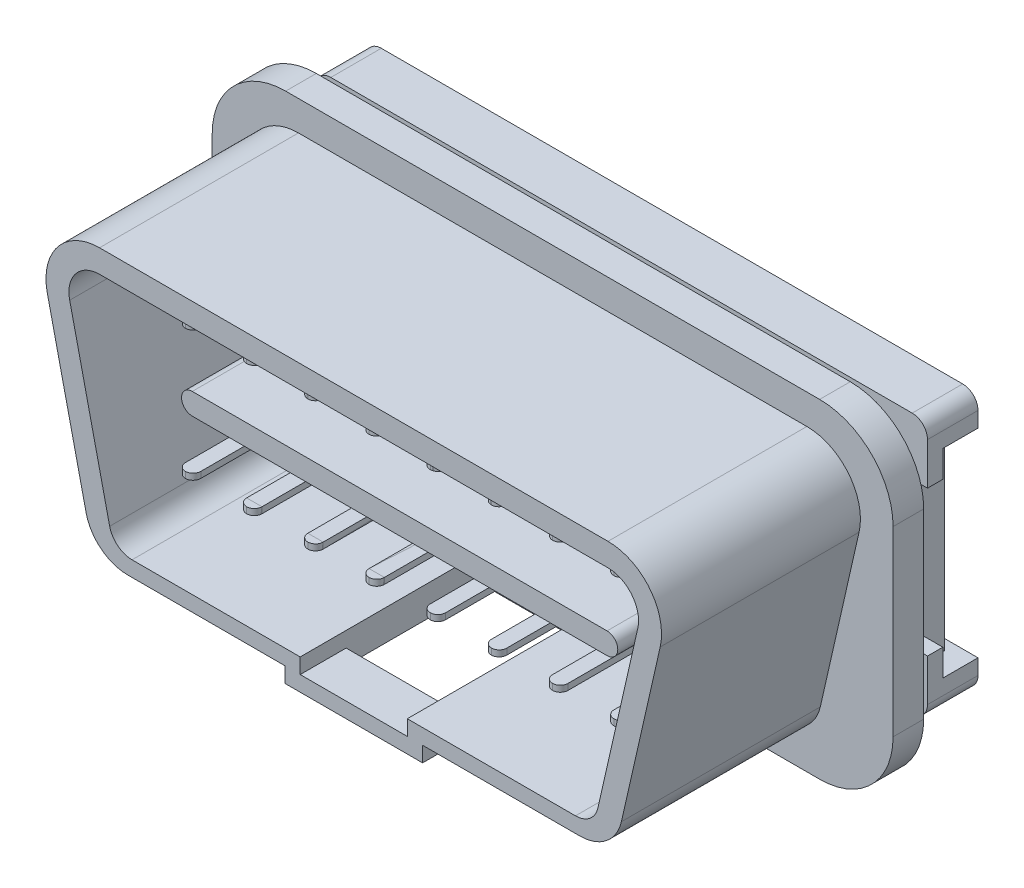
from build123d import *

# Parameters (mm, degrees)
SKETCH1_W             = 44.5
SKETCH1_H             = 21.5
BOSS_EXTRUDE1_DEPTH   = 2
BOSS_EXTRUDE2_DEPTH   = 13
SKETCH3_W             = 9
SKETCH3_H             = 1
BOSS_EXTRUDE3_DEPTH   = 13
SKETCH4_W             = 7
SKETCH4_H             = 1
CUT_EXTRUDE1_DEPTH    = 13
SKETCH5_W             = 7
SKETCH5_H             = 10
CUT_EXTRUDE2_DEPTH    = 34.200376504
BOSS_EXTRUDE4_DEPTH   = 10
SKETCH7_W             = 36
SKETCH7_H             = 13.5
BOSS_EXTRUDE5_DEPTH   = 2.5
SKETCH8_W             = 40
SKETCH8_H             = 3.75
BOSS_EXTRUDE6_DEPTH   = 1
SKETCH9_W             = 40
SKETCH9_H             = 2
BOSS_EXTRUDE7_DEPTH   = 2.3
SKETCH10_W            = 37
SKETCH10_H            = 13
BOSS_EXTRUDE8_DEPTH   = 1.6
BOSS_EXTRUDE9_START   = -8.6
SKETCH11_W            = 1
SKETCH11_H            = 0.4
BOSS_EXTRUDE9_DEPTH   = 18.6
BOSS_EXTRUDE9_2_DEPTH = 18.6
FILLET1_R             = 0.5
FILLET2_R             = 0.5
LPATTERN4_COUNT       = 4
LPATTERN4_PITCH       = 4
LPATTERN4_2_COUNT     = 5
LPATTERN4_2_PITCH     = 4
FILLET3_R             = 4.8
FILLET4_R             = 1


with BuildPart() as part:
    # Sketch1 → Boss-Extrude1 (new body)
    with BuildSketch(Plane.XY):
        Rectangle(SKETCH1_W, SKETCH1_H)
    extrude(amount=BOSS_EXTRUDE1_DEPTH)

    # Sketch2 → Boss-Extrude2 (add)
    with BuildSketch(Plane.XY.offset(2)):
        with BuildLine():
            Line((-16.615290945, 8.8), (16.615290945, 8.8))
            ThreePointArc((16.615290945, 8.8), (19.350693888, 7.483476755), (20.02825594, 4.524326137))
            Line((20.02825594, 4.524326137), (17.492629169, -6.632431655))
            ThreePointArc((17.492629169, -6.632431655), (16.514405691, -8.191660068), (14.77715587, -8.8))
            Line((14.77715587, -8.8), (-14.77715587, -8.8))
            ThreePointArc((-14.77715587, -8.8), (-16.514405691, -8.191660068), (-17.492629169, -6.632431655))
            Line((-17.492629169, -6.632431655), (-20.02825594, 4.524326137))
            ThreePointArc((-20.02825594, 4.524326137), (-19.350693888, 7.483476755), (-16.615290945, 8.8))
        make_face()
        with BuildLine():
            Line((-16.615290945, 7.3), (16.615290945, 7.3))
            ThreePointArc((16.615290945, 7.3), (18.178378341, 6.547701003), (18.565556657, 4.856757793))
            Line((18.565556657, 4.856757793), (15.954377237, -6.632431655))
            ThreePointArc((15.954377237, -6.632431655), (15.427453705, -7.472315547), (14.491677953, -7.8))
            Line((14.491677953, -7.8), (-14.491677953, -7.8))
            ThreePointArc((-14.491677953, -7.8), (-15.427453705, -7.472315547), (-15.954377237, -6.632431655))
            Line((-15.954377237, -6.632431655), (-18.565556657, 4.856757793))
            ThreePointArc((-18.565556657, 4.856757793), (-18.178378341, 6.547701003), (-16.615290945, 7.3))
        make_face(mode=Mode.SUBTRACT)
    extrude(amount=BOSS_EXTRUDE2_DEPTH)

    # Sketch3 → Boss-Extrude3 (add)
    with BuildSketch(Plane.XY.offset(15)):
        with Locations((0, -9.3)):
            Rectangle(SKETCH3_W, SKETCH3_H)
    extrude(amount=-BOSS_EXTRUDE3_DEPTH)

    # Sketch4 → Cut-Extrude1 (cut)
    with BuildSketch(Plane.XY.offset(15)):
        with Locations((0, -8.3)):
            Rectangle(SKETCH4_W, SKETCH4_H)
    extrude(amount=-CUT_EXTRUDE1_DEPTH, mode=Mode.SUBTRACT)

    # Sketch5 → Cut-Extrude2 (cut, through all)
    with BuildSketch(Plane(origin=(0, -8.8, 0), x_dir=(1, 0, 0), z_dir=(0, 1, 0))):
        with Locations((0, -7)):
            Rectangle(SKETCH5_W, SKETCH5_H)
    extrude(amount=-CUT_EXTRUDE2_DEPTH, mode=Mode.SUBTRACT)

    # Sketch6 → Boss-Extrude4 (add)
    with BuildSketch(Plane.XY.offset(2)):
        with BuildLine():
            Line((-13.555, 0.7), (13.555, 0.7))
            ThreePointArc((13.555, 0.7), (14.255, 0), (13.555, -0.7))
            Line((13.555, -0.7), (-13.555, -0.7))
            ThreePointArc((-13.555, -0.7), (-14.255, 0), (-13.555, 0.7))
        make_face()
    extrude(amount=BOSS_EXTRUDE4_DEPTH)

    # Sketch7 → Boss-Extrude5 (add)
    with BuildSketch(Plane(origin=(0, 0, 0), x_dir=(-1, 0, 0), z_dir=(0, 0, -1))):
        Rectangle(SKETCH7_W, SKETCH7_H)
    extrude(amount=BOSS_EXTRUDE5_DEPTH)

    # Sketch8 → Boss-Extrude6 (add)
    with BuildSketch(Plane(origin=(0, 0, -2.5), x_dir=(-1, 0, 0), z_dir=(0, 0, -1))):
        with Locations((0, 6.625)):
            Rectangle(SKETCH8_W, SKETCH8_H)
        with Locations((0, -6.625)):
            Rectangle(SKETCH8_W, SKETCH8_H)
    extrude(amount=BOSS_EXTRUDE6_DEPTH)

    # Sketch9 → Boss-Extrude7 (add)
    with BuildSketch(Plane(origin=(0, 0, -3.5), x_dir=(-1, 0, 0), z_dir=(0, 0, -1))):
        with Locations((0, 7.5)):
            Rectangle(SKETCH9_W, SKETCH9_H)
        with Locations((0, -7.5)):
            Rectangle(SKETCH9_W, SKETCH9_H)
    extrude(amount=BOSS_EXTRUDE7_DEPTH)

    # Fillet3
    fillet3_edges = [part.edges().sort_by_distance(p)[0] for p in [
        (22.25, -10.75, 1),
        (-22.25, -10.75, 1),
        (-22.25, 10.75, 1),
        (22.25, 10.75, 1),
    ]]
    fillet(fillet3_edges, radius=FILLET3_R)

    # Fillet4
    fillet4_edges = [part.edges().sort_by_distance(p)[0] for p in [
        (20, 8.5, -4.15),
        (-20, 8.5, -4.15),
        (20, -8.5, -4.15),
        (-20, -8.5, -4.15),
    ]]
    fillet(fillet4_edges, radius=FILLET4_R)


with BuildPart() as body_2:
    # Sketch10 → Boss-Extrude8 (new body)
    with BuildSketch(Plane(origin=(0, 0, -3.5), x_dir=(-1, 0, 0), z_dir=(0, 0, -1))):
        Rectangle(SKETCH10_W, SKETCH10_H)
    extrude(amount=BOSS_EXTRUDE8_DEPTH)


with BuildPart() as body_3:
    # Sketch11 → Boss-Extrude9 (new body)
    with BuildSketch(Plane.XY.offset(2).offset(BOSS_EXTRUDE9_START)):
        with Locations((2, 4.25)):
            Rectangle(SKETCH11_W, SKETCH11_H)
    extrude(amount=BOSS_EXTRUDE9_DEPTH)

    # Fillet1
    fillet1_edges = [body_3.edges().sort_by_distance(p)[0] for p in [
        (1.5, 4.25, 12),
        (2.5, 4.25, 12),
    ]]
    fillet(fillet1_edges, radius=FILLET1_R - 0.0001)  # a hair under: the kernel refuses the full size


with BuildPart() as body_4:
    # Sketch11 → Boss-Extrude9 2 (new body)
    with BuildSketch(Plane.XY.offset(2).offset(BOSS_EXTRUDE9_START)):
        with Locations((2, -4.25)):
            Rectangle(SKETCH11_W, SKETCH11_H)
    extrude(amount=BOSS_EXTRUDE9_2_DEPTH)

    # Fillet2
    fillet2_edges = [body_4.edges().sort_by_distance(p)[0] for p in [
        (1.5, -4.25, 12),
        (2.5, -4.25, 12),
    ]]
    fillet(fillet2_edges, radius=FILLET2_R - 0.0001)  # a hair under: the kernel refuses the full size


with BuildPart() as lpattern4_1:
    # LPattern4: pattern copy
    add(body_3.part.moved(Location(Vector(1, 0, 0) * (1 * LPATTERN4_PITCH))))


with BuildPart() as lpattern4_2:
    # LPattern4: pattern copy
    add(body_3.part.moved(Location(Vector(1, 0, 0) * (2 * LPATTERN4_PITCH))))


with BuildPart() as lpattern4_3:
    # LPattern4: pattern copy
    add(body_3.part.moved(Location(Vector(1, 0, 0) * (3 * LPATTERN4_PITCH))))


with BuildPart() as lpattern4_4:
    # LPattern4: pattern copy
    add(body_4.part.moved(Location(Vector(1, 0, 0) * (1 * LPATTERN4_PITCH))))


with BuildPart() as lpattern4_5:
    # LPattern4: pattern copy
    add(body_4.part.moved(Location(Vector(1, 0, 0) * (2 * LPATTERN4_PITCH))))


with BuildPart() as lpattern4_6:
    # LPattern4: pattern copy
    add(body_4.part.moved(Location(Vector(1, 0, 0) * (3 * LPATTERN4_PITCH))))


with BuildPart() as lpattern4_2_1:
    # LPattern4 2: pattern copy
    add(body_3.part.moved(Location(Vector(-1, 0, 0) * (1 * LPATTERN4_2_PITCH))))


with BuildPart() as lpattern4_2_2:
    # LPattern4 2: pattern copy
    add(body_3.part.moved(Location(Vector(-1, 0, 0) * (2 * LPATTERN4_2_PITCH))))


with BuildPart() as lpattern4_2_3:
    # LPattern4 2: pattern copy
    add(body_3.part.moved(Location(Vector(-1, 0, 0) * (3 * LPATTERN4_2_PITCH))))


with BuildPart() as lpattern4_2_4:
    # LPattern4 2: pattern copy
    add(body_3.part.moved(Location(Vector(-1, 0, 0) * (4 * LPATTERN4_2_PITCH))))


with BuildPart() as lpattern4_2_5:
    # LPattern4 2: pattern copy
    add(body_4.part.moved(Location(Vector(-1, 0, 0) * (1 * LPATTERN4_2_PITCH))))


with BuildPart() as lpattern4_2_6:
    # LPattern4 2: pattern copy
    add(body_4.part.moved(Location(Vector(-1, 0, 0) * (2 * LPATTERN4_2_PITCH))))


with BuildPart() as lpattern4_2_7:
    # LPattern4 2: pattern copy
    add(body_4.part.moved(Location(Vector(-1, 0, 0) * (3 * LPATTERN4_2_PITCH))))


with BuildPart() as lpattern4_2_8:
    # LPattern4 2: pattern copy
    add(body_4.part.moved(Location(Vector(-1, 0, 0) * (4 * LPATTERN4_2_PITCH))))


with BuildPart() as lpattern4_2_9:
    # LPattern4 2: pattern copy
    add(lpattern4_1.part.moved(Location(Vector(-1, 0, 0) * (1 * LPATTERN4_2_PITCH))))


with BuildPart() as lpattern4_2_10:
    # LPattern4 2: pattern copy
    add(lpattern4_1.part.moved(Location(Vector(-1, 0, 0) * (2 * LPATTERN4_2_PITCH))))


with BuildPart() as lpattern4_2_11:
    # LPattern4 2: pattern copy
    add(lpattern4_1.part.moved(Location(Vector(-1, 0, 0) * (3 * LPATTERN4_2_PITCH))))


with BuildPart() as lpattern4_2_12:
    # LPattern4 2: pattern copy
    add(lpattern4_1.part.moved(Location(Vector(-1, 0, 0) * (4 * LPATTERN4_2_PITCH))))


with BuildPart() as lpattern4_2_13:
    # LPattern4 2: pattern copy
    add(lpattern4_2.part.moved(Location(Vector(-1, 0, 0) * (1 * LPATTERN4_2_PITCH))))


with BuildPart() as lpattern4_2_14:
    # LPattern4 2: pattern copy
    add(lpattern4_2.part.moved(Location(Vector(-1, 0, 0) * (2 * LPATTERN4_2_PITCH))))


with BuildPart() as lpattern4_2_15:
    # LPattern4 2: pattern copy
    add(lpattern4_2.part.moved(Location(Vector(-1, 0, 0) * (3 * LPATTERN4_2_PITCH))))


with BuildPart() as lpattern4_2_16:
    # LPattern4 2: pattern copy
    add(lpattern4_2.part.moved(Location(Vector(-1, 0, 0) * (4 * LPATTERN4_2_PITCH))))


with BuildPart() as lpattern4_2_17:
    # LPattern4 2: pattern copy
    add(lpattern4_3.part.moved(Location(Vector(-1, 0, 0) * (1 * LPATTERN4_2_PITCH))))


with BuildPart() as lpattern4_2_18:
    # LPattern4 2: pattern copy
    add(lpattern4_3.part.moved(Location(Vector(-1, 0, 0) * (2 * LPATTERN4_2_PITCH))))


with BuildPart() as lpattern4_2_19:
    # LPattern4 2: pattern copy
    add(lpattern4_3.part.moved(Location(Vector(-1, 0, 0) * (3 * LPATTERN4_2_PITCH))))


with BuildPart() as lpattern4_2_20:
    # LPattern4 2: pattern copy
    add(lpattern4_3.part.moved(Location(Vector(-1, 0, 0) * (4 * LPATTERN4_2_PITCH))))


with BuildPart() as lpattern4_2_21:
    # LPattern4 2: pattern copy
    add(lpattern4_4.part.moved(Location(Vector(-1, 0, 0) * (1 * LPATTERN4_2_PITCH))))


with BuildPart() as lpattern4_2_22:
    # LPattern4 2: pattern copy
    add(lpattern4_4.part.moved(Location(Vector(-1, 0, 0) * (2 * LPATTERN4_2_PITCH))))


with BuildPart() as lpattern4_2_23:
    # LPattern4 2: pattern copy
    add(lpattern4_4.part.moved(Location(Vector(-1, 0, 0) * (3 * LPATTERN4_2_PITCH))))


with BuildPart() as lpattern4_2_24:
    # LPattern4 2: pattern copy
    add(lpattern4_4.part.moved(Location(Vector(-1, 0, 0) * (4 * LPATTERN4_2_PITCH))))


with BuildPart() as lpattern4_2_25:
    # LPattern4 2: pattern copy
    add(lpattern4_5.part.moved(Location(Vector(-1, 0, 0) * (1 * LPATTERN4_2_PITCH))))


with BuildPart() as lpattern4_2_26:
    # LPattern4 2: pattern copy
    add(lpattern4_5.part.moved(Location(Vector(-1, 0, 0) * (2 * LPATTERN4_2_PITCH))))


with BuildPart() as lpattern4_2_27:
    # LPattern4 2: pattern copy
    add(lpattern4_5.part.moved(Location(Vector(-1, 0, 0) * (3 * LPATTERN4_2_PITCH))))


with BuildPart() as lpattern4_2_28:
    # LPattern4 2: pattern copy
    add(lpattern4_5.part.moved(Location(Vector(-1, 0, 0) * (4 * LPATTERN4_2_PITCH))))


with BuildPart() as lpattern4_2_29:
    # LPattern4 2: pattern copy
    add(lpattern4_6.part.moved(Location(Vector(-1, 0, 0) * (1 * LPATTERN4_2_PITCH))))


with BuildPart() as lpattern4_2_30:
    # LPattern4 2: pattern copy
    add(lpattern4_6.part.moved(Location(Vector(-1, 0, 0) * (2 * LPATTERN4_2_PITCH))))


with BuildPart() as lpattern4_2_31:
    # LPattern4 2: pattern copy
    add(lpattern4_6.part.moved(Location(Vector(-1, 0, 0) * (3 * LPATTERN4_2_PITCH))))


with BuildPart() as lpattern4_2_32:
    # LPattern4 2: pattern copy
    add(lpattern4_6.part.moved(Location(Vector(-1, 0, 0) * (4 * LPATTERN4_2_PITCH))))


solid = Compound([part.part, body_2.part, body_3.part, body_4.part, lpattern4_1.part, lpattern4_2.part, lpattern4_3.part, lpattern4_4.part, lpattern4_5.part, lpattern4_6.part, lpattern4_2_1.part, lpattern4_2_2.part, lpattern4_2_3.part, lpattern4_2_4.part, lpattern4_2_5.part, lpattern4_2_6.part, lpattern4_2_7.part, lpattern4_2_8.part, lpattern4_2_9.part, lpattern4_2_10.part, lpattern4_2_11.part, lpattern4_2_12.part, lpattern4_2_13.part, lpattern4_2_14.part, lpattern4_2_15.part, lpattern4_2_16.part, lpattern4_2_17.part, lpattern4_2_18.part, lpattern4_2_19.part, lpattern4_2_20.part, lpattern4_2_21.part, lpattern4_2_22.part, lpattern4_2_23.part, lpattern4_2_24.part, lpattern4_2_25.part, lpattern4_2_26.part, lpattern4_2_27.part, lpattern4_2_28.part, lpattern4_2_29.part, lpattern4_2_30.part, lpattern4_2_31.part, lpattern4_2_32.part])
